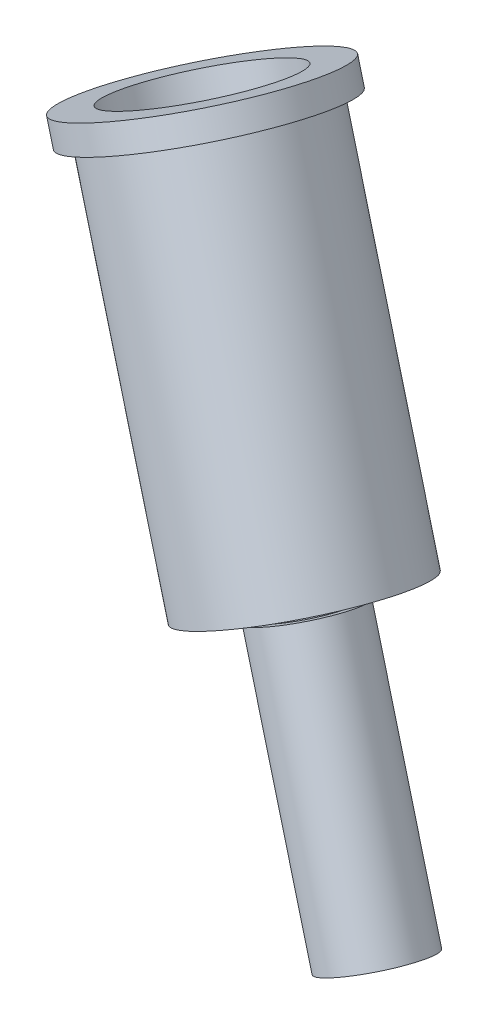
from build123d import *

# Parameters (mm, degrees)
SKETCH1_R           = 11.43
BOSS_EXTRUDE1_DEPTH = 2.54
SKETCH2_R           = 9.9949
BOSS_EXTRUDE2_DEPTH = 35.56
SKETCH3_R           = 3.81
BOSS_EXTRUDE3_DEPTH = 1.016
SKETCH4_R           = 4.7625
BOSS_EXTRUDE4_DEPTH = 26.02818833
SKETCH5_R           = 3.175
CUT_EXTRUDE1_DEPTH  = 90.027624948
SKETCH6_R           = 7.9375
CUT_EXTRUDE2_DEPTH  = 22.86


with BuildPart() as part:
    # Sketch1 → Boss-Extrude1 (new body)
    with BuildSketch(Plane(origin=(-129.203450499, 253.122013832, -50.271342949), x_dir=(0.8839119577418659, 0.40461078724322996, -0.23449895907520743), z_dir=(-0.4476862825736014, 0.8770605813697528, -0.1741887740435096))):
        with Locations((-31.085661697, -28.519102589)):
            Circle(SKETCH1_R)
    extrude(amount=BOSS_EXTRUDE1_DEPTH)

    # Sketch2 → Boss-Extrude2 (add)
    with BuildSketch(Plane(origin=(-129.203450499, 253.122013832, -50.271342949), x_dir=(-0.8839119577418658, -0.4046107872432301, 0.23449895907520704), z_dir=(0.44768628257360144, -0.8770605813697528, 0.17418877404350955))):
        with Locations((31.085661697, -28.519102589)):
            Circle(SKETCH2_R)
    extrude(amount=BOSS_EXTRUDE2_DEPTH)

    # Sketch3 → Boss-Extrude3 (add)
    with BuildSketch(Plane(origin=(-113.283726291, 221.933739558, -44.077190144), x_dir=(-0.8839119577418658, -0.40461078724323, 0.2344989590752073), z_dir=(0.44768628257360144, -0.8770605813697528, 0.17418877404350946))):
        with Locations((31.085661697, -28.519102589)):
            Circle(SKETCH3_R)
    extrude(amount=BOSS_EXTRUDE3_DEPTH)

    # Sketch4 → Boss-Extrude4 (add)
    with BuildSketch(Plane(origin=(-112.828877028, 221.042646008, -43.900214349), x_dir=(-0.8839119577418657, -0.40461078724322985, 0.23449895907520799), z_dir=(0.4476862825736014, -0.8770605813697527, 0.1741887740435095))):
        with Locations((31.085661697, -28.519102589)):
            Circle(SKETCH4_R)
    extrude(amount=BOSS_EXTRUDE4_DEPTH)

    # Sketch5 → Cut-Extrude1 (cut, through all)
    with BuildSketch(Plane(origin=(-130.340573657, 255.349747708, -50.713782435), x_dir=(0.8839119577418658, 0.40461078724323, -0.2344989590752073), z_dir=(-0.4476862825736014, 0.8770605813697528, -0.1741887740435095))):
        with Locations((-31.085661697, -28.519102589)):
            Circle(SKETCH5_R)
    extrude(amount=-CUT_EXTRUDE1_DEPTH, mode=Mode.SUBTRACT)

    # Sketch6 → Cut-Extrude2 (cut)
    with BuildSketch(Plane(origin=(-130.340573657, 255.349747708, -50.713782435), x_dir=(0.8839119577418658, 0.40461078724323, -0.2344989590752073), z_dir=(-0.4476862825736014, 0.8770605813697528, -0.1741887740435095))):
        with Locations((-31.085661697, -28.519102589)):
            Circle(SKETCH6_R)
    extrude(amount=-CUT_EXTRUDE2_DEPTH, mode=Mode.SUBTRACT)


solid = part.part
